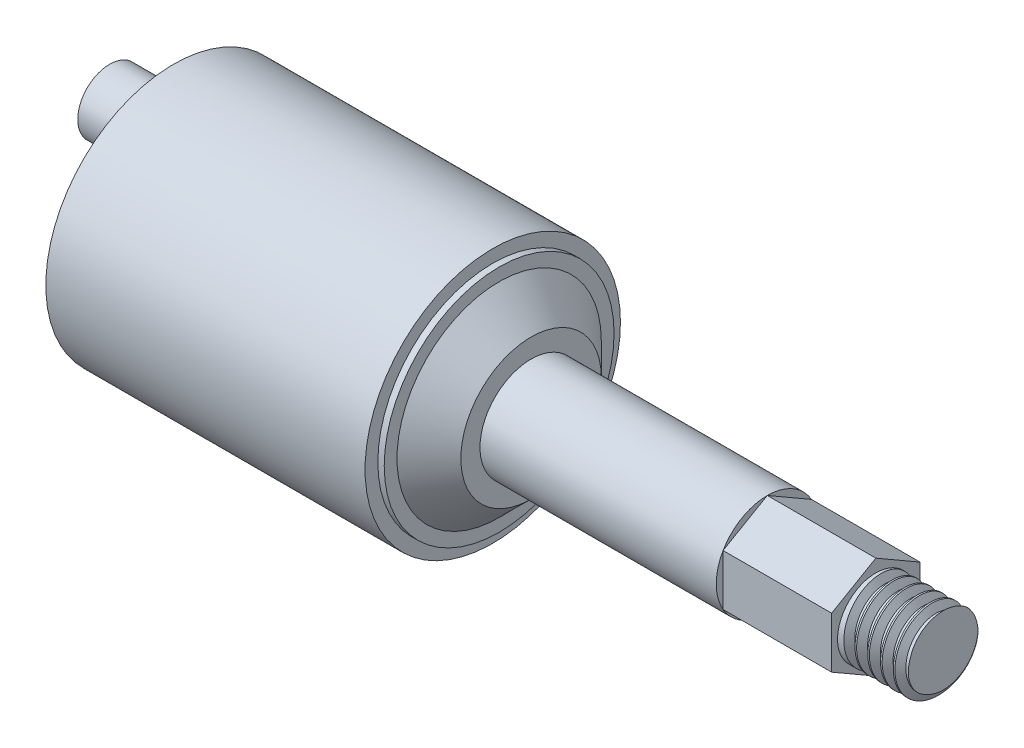
from build123d import *

# Parameters (mm, degrees)
SKETCH1_R           = 20
BOSS_EXTRUDE1_DEPTH = 50
SKETCH2_R           = 5
BOSS_EXTRUDE2_DEPTH = 10
SKETCH3_R           = 18
BOSS_EXTRUDE3_DEPTH = 1
SKETCH4_R           = 16
BOSS_EXTRUDE4_DEPTH = 5
BOSS_EXTRUDE4_TAPER = 45
SKETCH5_R           = 8
BOSS_EXTRUDE5_DEPTH = 37
BOSS_EXTRUDE6_DEPTH = 17
SKETCH7_R           = 6
BOSS_EXTRUDE7_DEPTH = 10
THREAD1_PITCH       = 2


with BuildPart() as part:
    # Sketch1 → Boss-Extrude1 (new body)
    with BuildSketch(Plane(origin=(0, 0, 0), x_dir=(0, 0, -1), z_dir=(1, 0, 0))):
        Circle(SKETCH1_R)
    extrude(amount=BOSS_EXTRUDE1_DEPTH)

    # Sketch2 → Boss-Extrude2 (add)
    with BuildSketch(Plane.ZY):
        with Locations(Location((0, 10, 0), (0, 0, 180))):
            Circle(SKETCH2_R)
        with Locations(Location((0, -10, 0), (0, 0, 180))):
            Circle(SKETCH2_R)
    extrude(amount=BOSS_EXTRUDE2_DEPTH)

    # Sketch3 → Boss-Extrude3 (add)
    with BuildSketch(Plane(origin=(50, 0, 0), x_dir=(0, 0, -1), z_dir=(1, 0, 0))):
        Circle(SKETCH3_R)
    extrude(amount=BOSS_EXTRUDE3_DEPTH)

    # Sketch4 → Boss-Extrude4 (add)
    with BuildSketch(Plane(origin=(51, 0, 0), x_dir=(0, 0, -1), z_dir=(1, 0, 0))):
        Circle(SKETCH4_R)
    extrude(amount=BOSS_EXTRUDE4_DEPTH, taper=BOSS_EXTRUDE4_TAPER)

    # Sketch5 → Boss-Extrude5 (add)
    with BuildSketch(Plane(origin=(56, 0, 0), x_dir=(0, 0, -1), z_dir=(1, 0, 0))):
        Circle(SKETCH5_R)
    extrude(amount=BOSS_EXTRUDE5_DEPTH)

    # Sketch6 → Boss-Extrude6 (add)
    with BuildSketch(Plane(origin=(93, 0, 0), x_dir=(0, 0, -1), z_dir=(1, 0, 0))):
        Polygon((6.92820323, 4), (0, 8), (-6.92820323, 4), (-6.92820323, -4), (0, -8), (6.92820323, -4), align=None)
    extrude(amount=BOSS_EXTRUDE6_DEPTH)

    # Sketch7 → Boss-Extrude7 (add)
    with BuildSketch(Plane(origin=(110, 0, 0), x_dir=(0, 0, -1), z_dir=(1, 0, 0))):
        Circle(SKETCH7_R)
    extrude(amount=BOSS_EXTRUDE7_DEPTH)

    # Thread1: the profile of Thread Profile1 profile screwed along a right-hand helix of 5 turns, 10 arcs to a turn; built about Z, then put on its axis
    thread1_z = Axis((0, 0, 0), (0, 0, 1))
    thread1_corners = [(6.0003, 0, -0.000173205), (6.0003, 0, 1.7501732), (4.91746825, 0, 1.124999997), (4.91746825, 0, 0.624999997)]
    with BuildLine(mode=Mode.PRIVATE) as thread1_profile:
        Line(thread1_corners[0], thread1_corners[1])
        Line(thread1_corners[1], thread1_corners[2])
        Line(thread1_corners[2], thread1_corners[3])
        Line(thread1_corners[3], thread1_corners[0])
    thread1_cap = Face(thread1_profile.wire())
    thread1_turn_angles = [0, 18, 36, 54, 72, 90, 108, 126, 144, 162, 180, 198, 216, 234, 252, 270, 288, 306, 324, 342, 360]
    thread1_turn_weights = [1, 0.9510565162951535, 1, 0.9510565162951535, 1, 0.9510565162951535, 1, 0.9510565162951535, 1, 0.9510565162951535, 1, 0.9510565162951535, 1, 0.9510565162951535, 1, 0.9510565162951535, 1, 0.9510565162951535, 1, 0.9510565162951535, 1]
    thread1_turn_rails = [Edge.make_bspline([Vector(p[0], p[1], 0).rotate(thread1_z, thread1_turn_angles[k]) / thread1_turn_weights[k] + Vector(0, 0, p[2] + THREAD1_PITCH * thread1_turn_angles[k] / 360) for k in range(21)], [0, 0, 0, 1, 1, 2, 2, 3, 3, 4, 4, 5, 5, 6, 6, 7, 7, 8, 8, 9, 9, 10, 10, 10], 2, thread1_turn_weights) for p in thread1_corners]
    thread1_turn_sides = [Face.make_surface_from_curves(thread1_turn_rails[p[0]], thread1_turn_rails[p[1]]) for p in [(0, 1), (1, 2), (2, 3), (3, 0)]]
    thread1 = Plane(origin=(110, 0, 0), x_dir=(0, 0, -1), z_dir=(1, 0, 0)) * Solid(Shell([*[p.moved(Location((0, 0, THREAD1_PITCH * i))) for i in range(5) for p in thread1_turn_sides], thread1_cap, thread1_cap.rotate(thread1_z, 1800).moved(Location((0, 0, THREAD1_PITCH * 1800 / 360)))]))
    add(thread1, mode=Mode.SUBTRACT)


solid = part.part
